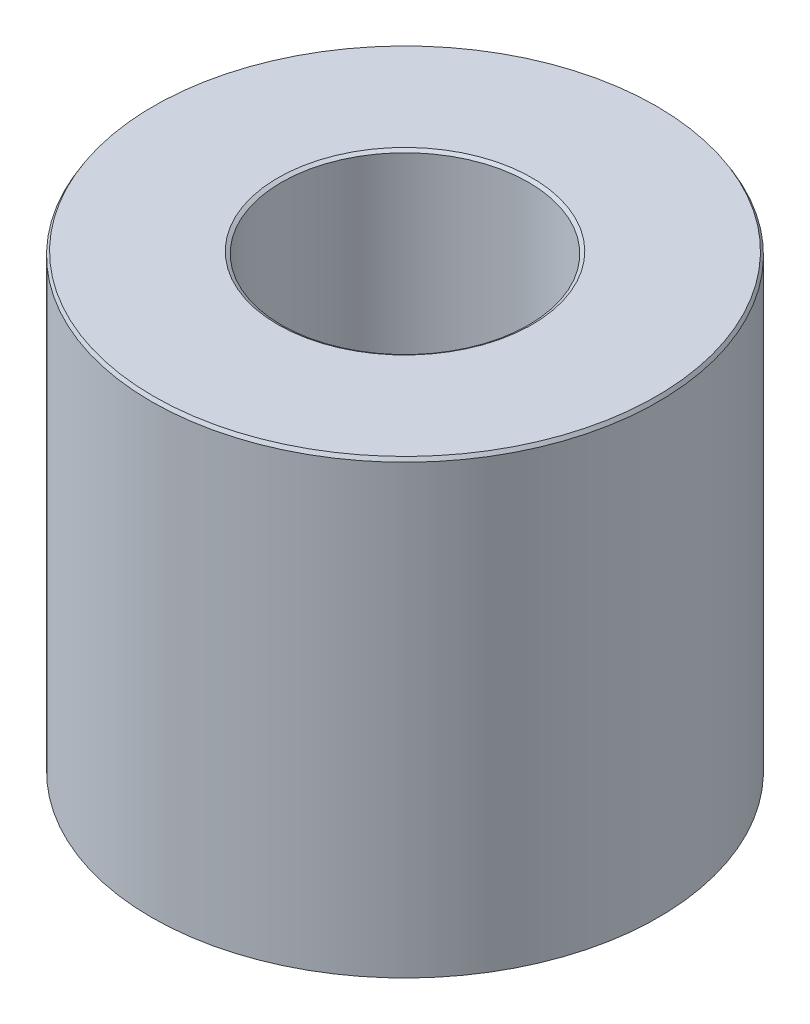
from build123d import *
from OCP.BRepFilletAPI import BRepFilletAPI_MakeChamfer

# Parameters (mm, degrees)
SKETCH1_R           = 50
BOSS_EXTRUDE1_DEPTH = 89.214004941
SKETCH2_R           = 24.381979347
CUT_EXTRUDE1_DEPTH  = 114.83821273
CHAMFER1_SIZE       = 0.693268927
CHAMFER1_SIZE2      = 0.42114284


with BuildPart() as part:
    # Sketch1 → Boss-Extrude1 (new body)
    with BuildSketch(Plane(origin=(0, 0, 0), x_dir=(1, 0, 0), z_dir=(0, 1, 0))):
        Circle(SKETCH1_R)
    extrude(amount=BOSS_EXTRUDE1_DEPTH)

    # Sketch2 → Cut-Extrude1 (cut, through all)
    with BuildSketch(Plane(origin=(0, 0, 0), x_dir=(1, 0, 0), z_dir=(0, 1, 0))):
        Circle(SKETCH2_R)
    extrude(amount=CUT_EXTRUDE1_DEPTH, mode=Mode.SUBTRACT)

    # Chamfer1: one chamfer whose edges measure the first distance from different faces: ONE call of the kernel's chamfer builder (chamfer() names one face for all edges)
    chamfer1_edges_1 = [part.edges().sort_by_distance(p)[0] for p in [
        (-24.381979347, 89.214004941, 0),
    ]]
    chamfer1_side_1 = [part.faces().sort_by_distance(p)[0] for p in [
        (-48.585786438, 89.214004941, 0),
    ]]
    chamfer1_edges_2 = [part.edges().sort_by_distance(p)[0] for p in [
        (-24.381979347, 0, 0),
    ]]
    chamfer1_side_2 = [part.faces().sort_by_distance(p)[0] for p in [
        (-24.381979347, 44.607002471, 0),
    ]]
    chamfer1_edges_3 = [part.edges().sort_by_distance(p)[0] for p in [
        (-50, 0, 0),
    ]]
    chamfer1_side_3 = [part.faces().sort_by_distance(p)[0] for p in [
        (-48.585786438, 0, 0),
    ]]
    chamfer1_edges_4 = [part.edges().sort_by_distance(p)[0] for p in [
        (-50, 89.214004941, 0),
    ]]
    chamfer1_side_4 = [part.faces().sort_by_distance(p)[0] for p in [
        (-50, 44.607002471, 0),
    ]]
    chamfer1 = BRepFilletAPI_MakeChamfer(part.part.solid().wrapped)
    for e in chamfer1_edges_1:
        chamfer1.Add(CHAMFER1_SIZE, CHAMFER1_SIZE2, e.wrapped, chamfer1_side_1[0].wrapped)  # the first distance lies on this face
    for e in chamfer1_edges_2:
        chamfer1.Add(CHAMFER1_SIZE, CHAMFER1_SIZE2, e.wrapped, chamfer1_side_2[0].wrapped)  # the first distance lies on this face
    for e in chamfer1_edges_3:
        chamfer1.Add(CHAMFER1_SIZE, CHAMFER1_SIZE2, e.wrapped, chamfer1_side_3[0].wrapped)  # the first distance lies on this face
    for e in chamfer1_edges_4:
        chamfer1.Add(CHAMFER1_SIZE, CHAMFER1_SIZE2, e.wrapped, chamfer1_side_4[0].wrapped)  # the first distance lies on this face
    add(Compound.cast(chamfer1.Shape()), mode=Mode.REPLACE)


solid = part.part
